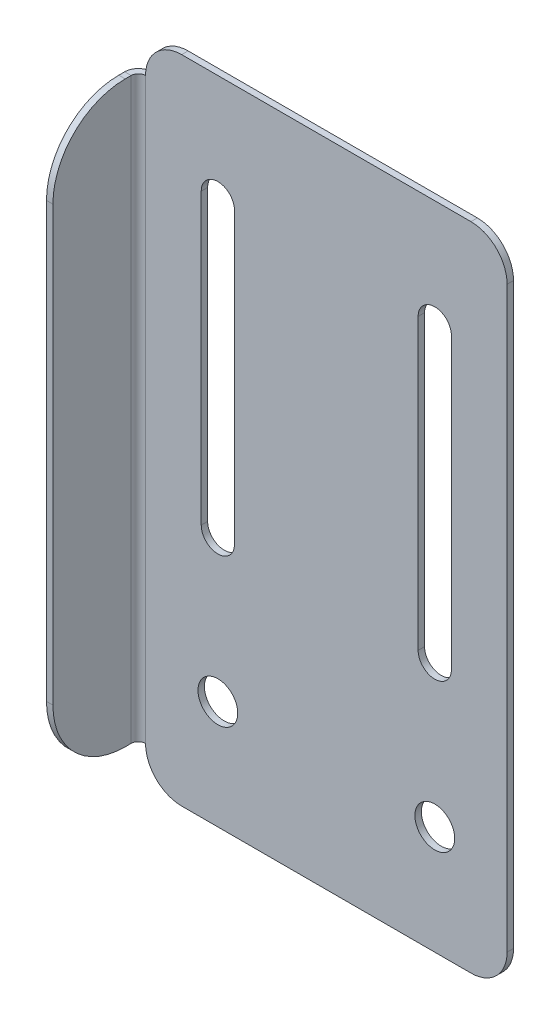
from build123d import *

# Parameters (mm, degrees)
SKETCH1_W           = 50
SKETCH1_H           = 90
BOSS_EXTRUDE1_DEPTH = 0.889
SKETCH2_R           = 2.75
CUT_EXTRUDE1_DEPTH  = 117.345408204
BREAK_CORNER1_DEPTH = 0.889
EDGE_FLANGE1_DEPTH  = 80
BREAK_CORNER2_START = 49.812591379
BREAK_CORNER2_DEPTH = 0.889


# Read off the part's stored shape, not the designer's step: Break-Corner1, Break-Corner2
# Sheet-metal steps are written as plain solids
with BuildPart() as part:
    # Sketch1 → Boss-Extrude1 (new body)
    with BuildSketch(Plane.XY):
        with Locations((76.701591379, -11.5)):
            Rectangle(SKETCH1_W, SKETCH1_H)
    extrude(amount=BOSS_EXTRUDE1_DEPTH)

    # Sketch2 → Cut-Extrude1 (cut, through all)
    with BuildSketch(Plane(origin=(0, 0, 0.889), x_dir=(-1, 0, 0), z_dir=(0, 0, -1))):
        with Locations((-61.701591379, -41.5)):
            Circle(SKETCH2_R)
        with Locations((-91.701591379, -41.5)):
            Circle(SKETCH2_R)
        with BuildLine():
            Line((-64.001591379, -21.5), (-64.001591379, 18.5))
            ThreePointArc((-64.001591379, 18.5), (-61.701591379, 20.8), (-59.401591379, 18.5))
            Line((-59.401591379, 18.5), (-59.401591379, -21.5))
            ThreePointArc((-59.401591379, -21.5), (-61.701591379, -23.8), (-64.001591379, -21.5))
        make_face()
        with BuildLine():
            Line((-94.001591379, -21.5), (-94.001591379, 18.5))
            ThreePointArc((-94.001591379, 18.5), (-91.701591379, 20.8), (-89.401591379, 18.5))
            Line((-89.401591379, 18.5), (-89.401591379, -21.5))
            ThreePointArc((-89.401591379, -21.5), (-91.701591379, -23.8), (-94.001591379, -21.5))
        make_face()
    extrude(amount=CUT_EXTRUDE1_DEPTH, mode=Mode.SUBTRACT)

    # Break-Corner1 outline → Break-Corner1 (cut)
    with BuildSketch(Plane.XY):
        with BuildLine():
            ThreePointArc((51.701591379, 28.5), (53.166057473, 32.035533906), (56.701591379, 33.5))
            Line((56.701591379, 33.5), (51.701591379, 33.5))
            Line((51.701591379, 33.5), (51.701591379, 28.5))
        make_face()
        with BuildLine():
            Line((101.701591379, 33.5), (96.701591379, 33.5))
            ThreePointArc((96.701591379, 33.5), (100.237125285, 32.035533906), (101.701591379, 28.5))
            Line((101.701591379, 28.5), (101.701591379, 33.5))
        make_face()
        with BuildLine():
            ThreePointArc((56.701591379, -56.5), (53.166057474, -55.035533906), (51.701591379, -51.5))
            Line((51.701591379, -51.5), (51.701591379, -56.5))
            Line((51.701591379, -56.5), (56.701591379, -56.5))
        make_face()
        with BuildLine():
            Line((101.701591379, -56.5), (101.701591379, -51.5))
            ThreePointArc((101.701591379, -51.5), (100.237125285, -55.035533906), (96.701591379, -56.5))
            Line((96.701591379, -56.5), (101.701591379, -56.5))
        make_face()
    extrude(amount=BREAK_CORNER1_DEPTH, mode=Mode.SUBTRACT)

    # Edge-Flange1 section (across the edge) → Edge-Flange1 (add)
    with BuildSketch(Plane(origin=(50.701591379, 28.5, 0.889), x_dir=(1, 0, 0), z_dir=(0, -1, 0))):
        with BuildLine():
            Line((-0.889, 1), (-0.889, 11.811))
            Line((-0.889, 11.811), (0, 11.811))
            Line((0, 11.811), (0, 1))
            ThreePointArc((0, 1), (0.292893219, 0.292893219), (1, 0))
            Line((1, 0), (1, -0.889))
            ThreePointArc((1, -0.889), (-0.33572471, -0.33572471), (-0.889, 1))
        make_face()
    extrude(amount=EDGE_FLANGE1_DEPTH)

    # Break-Corner2 outline → Break-Corner2 (cut)
    with BuildSketch(Plane.YZ.offset(BREAK_CORNER2_START)):
        with BuildLine():
            ThreePointArc((-51.5, 2.7), (-48.571067812, 9.771067812), (-41.5, 12.7))
            Line((-41.5, 12.7), (-51.5, 12.7))
            Line((-51.5, 12.7), (-51.5, 2.7))
        make_face()
        with BuildLine():
            Line((28.5, 12.7), (18.5, 12.7))
            ThreePointArc((18.5, 12.7), (25.571067812, 9.771067812), (28.5, 2.7))
            Line((28.5, 2.7), (28.5, 12.7))
        make_face()
    extrude(amount=BREAK_CORNER2_DEPTH, mode=Mode.SUBTRACT)


solid = part.part
